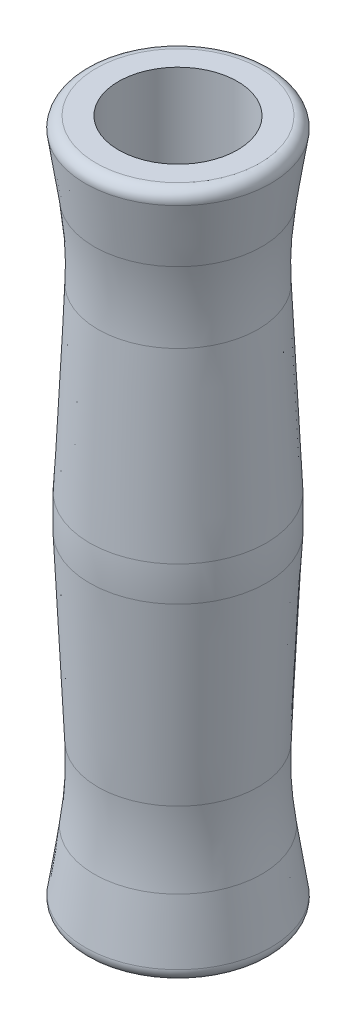
from build123d import *

# Parameters (mm, degrees)
FILLET_1_R          = 2
FILLET_2_R          = 70
SKETCH_2_R          = 11
CUT_EXTRUDE_1_DEPTH = 130.302519771


with BuildPart() as part:
    # Эскиз1 → Повернуть1 (revolve)
    with BuildSketch(Plane.XY, mode=Mode.PRIVATE) as revolve_1_sk:
        Polygon((0, 0), (17.5, 0), (14.5, -20), (16.5, -63.5), (14.5, -107), (17.5, -127), (0, -127), align=None)
    revolve(revolve_1_sk.sketch.rotate(Axis((0, 24.4253472, 0), (0, -1, 0)), 90), axis=Axis((0, 24.4253472, 0), (0, -1, 0)))

    # Скругление1
    fillet_1_edges = [part.edges().sort_by_distance(p)[0] for p in [
        (0, 0, -17.5),
        (0, -127, -17.5),
    ]]
    fillet(fillet_1_edges, radius=FILLET_1_R)

    # Скругление2
    # the kernel refuses this fillet: 70 mm, written as the material it adds along each edge
    with BuildSketch(Plane(origin=(0, -20, 0), x_dir=(0, 0, 1), z_dir=(1, 0, 0))) as fillet_2_piece_1:
        with BuildLine():
            CenterArc((14.5 + FILLET_2_R * 1.00343316746, FILLET_2_R * 0.0516950223501), FILLET_2_R, 177.367565131, 11.163200479)
            Line((14.5 + FILLET_2_R * 0.00448843750259, FILLET_2_R * 0.0976235156813), (14.5 - FILLET_2_R * 0.0154904570965, FILLET_2_R * 0.0985420855479))
            Line((14.5 - FILLET_2_R * 0.0154904570965, FILLET_2_R * 0.0985420855479), (14.5 - FILLET_2_R * 0.0200686633491, -FILLET_2_R * 0.001033900447))
            Line((14.5 - FILLET_2_R * 0.0200686633491, -FILLET_2_R * 0.001033900447), (14.5 - FILLET_2_R * 0.00528191247035, -FILLET_2_R * 0.0996122396387))
            Line((14.5 - FILLET_2_R * 0.00528191247035, -FILLET_2_R * 0.0996122396387), (14.5 + FILLET_2_R * 0.014496814587, -FILLET_2_R * 0.0966454305801))
        make_face()
    revolve(axis=Axis((0, -20, 0), (0, -1, 0)))
    with BuildSketch(Plane(origin=(0, -107, 0), x_dir=(0, 0, 1), z_dir=(1, 0, 0))) as fillet_2_piece_2:
        with BuildLine():
            CenterArc((14.5 + FILLET_2_R * 1.00343316746, -FILLET_2_R * 0.0516950223501), FILLET_2_R, 171.46923439, 11.163200479)
            Line((14.5 + FILLET_2_R * 0.014496814587, FILLET_2_R * 0.0966454305801), (14.5 - FILLET_2_R * 0.00528191247035, FILLET_2_R * 0.0996122396387))
            Line((14.5 - FILLET_2_R * 0.00528191247035, FILLET_2_R * 0.0996122396387), (14.5 - FILLET_2_R * 0.0200686633491, FILLET_2_R * 0.001033900447))
            Line((14.5 - FILLET_2_R * 0.0200686633491, FILLET_2_R * 0.001033900447), (14.5 - FILLET_2_R * 0.0154904570965, -FILLET_2_R * 0.0985420855479))
            Line((14.5 - FILLET_2_R * 0.0154904570965, -FILLET_2_R * 0.0985420855479), (14.5 + FILLET_2_R * 0.00448843750259, -FILLET_2_R * 0.0976235156813))
        make_face()
    revolve(axis=Axis((0, -107, 0), (0, -1, 0)))
    # the kernel refuses this fillet: 70 mm, written as the material it takes off along each edge
    with BuildSketch(Plane(origin=(0, -63.5, 0), x_dir=(0, 0, 1), z_dir=(1, 0, 0))) as fillet_2_2_piece_1:
        with BuildLine():
            CenterArc((16.5 - FILLET_2_R * 1.00105638482, 0), FILLET_2_R, 357.367565131, 5.264869738)
            Line((16.5 - FILLET_2_R * 0.0021116548658, FILLET_2_R * 0.0459284933312), (16.5 + FILLET_2_R * 0.0178672397333, FILLET_2_R * 0.0468470631978))
            Line((16.5 + FILLET_2_R * 0.0178672397333, FILLET_2_R * 0.0468470631978), (16.5 + FILLET_2_R * 0.0200211276964, 0))
            Line((16.5 + FILLET_2_R * 0.0200211276964, 0), (16.5 + FILLET_2_R * 0.0178672397333, -FILLET_2_R * 0.0468470631978))
            Line((16.5 + FILLET_2_R * 0.0178672397333, -FILLET_2_R * 0.0468470631978), (16.5 - FILLET_2_R * 0.0021116548658, -FILLET_2_R * 0.0459284933312))
        make_face()
    revolve(axis=Axis((0, -63.5, 0), (0, -1, 0)), mode=Mode.SUBTRACT)

    # Эскиз2 → Вырез-Вытянуть1 (cut, through all)
    with BuildSketch(Plane(origin=(0, 0, 0), x_dir=(1, 0, 0), z_dir=(0, 1, 0))):
        with Locations(Location((0, 0, 0), (0, 0, 270))):
            Circle(SKETCH_2_R)
    extrude(amount=-CUT_EXTRUDE_1_DEPTH, mode=Mode.SUBTRACT)


solid = part.part
